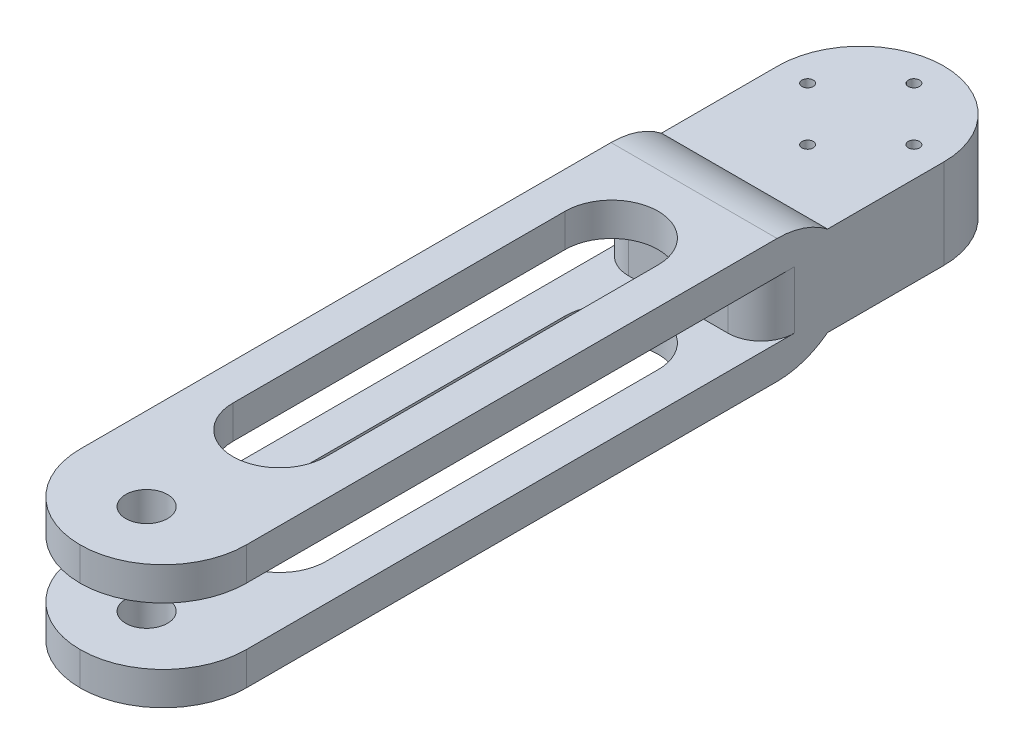
from build123d import *

# Parameters (mm, degrees)
BOSS_EXTRU_1_DEPTH      = 12.5
CONG_1_R                = 12.5
ESQUISSE2_R             = 0.85
ENL_V_MAT_EXTRU_1_DEPTH = 122.715469949
ESQUISSE3_R             = 3.15
ENL_V_MAT_EXTRU_2_DEPTH = 123.082236628
ENL_V_MAT_EXTRU_3_DEPTH = 123.082236628
CONG_2_R                = 5


with BuildPart() as part:
    # Esquisse1 → Boss.-Extru.1 (new, symmetric)
    with BuildSketch(Plane(origin=(0, 0, 0), x_dir=(0, 0, -1), z_dir=(1, 0, 0))):
        Polygon((90, 9.325), (-10, 9.325), (-10, 4.325), (80, 4.325), (80, -4.325), (-10, -4.325), (-10, -9.325), (90, -9.325), (90, -6.75), (120, -6.75), (120, 6.75), (90, 6.75), align=None)
    extrude(amount=BOSS_EXTRU_1_DEPTH, both=True)

    # Congé1
    # the kernel refuses this fillet: 12.5 mm, written as the material it takes off along each edge
    with BuildSketch(Plane(origin=(-31.497429925, -9.325, -90), x_dir=(0, 1, 0), z_dir=(1, 0, 0))) as cong_1_piece_1:
        with BuildLine():
            CenterArc((12.5, 7.59897197), CONG_1_R, 180, 37.439095089)
            Line((0, 7.59897197), (-0.25, 7.59897197))
            Line((-0.25, 7.59897197), (-0.25, 0))
            Line((-0.25, 0), (0, -0.25))
            ThreePointArc((0, -0.25), (1.2875, -0.25), (2.3765, -0.151979439))
            Line((2.3765, -0.151979439), (2.575, 0))
        make_face()
    extrude(amount=62.99485985, mode=Mode.SUBTRACT)
    with BuildSketch(Plane(origin=(31.497429925, 9.325, -90), x_dir=(0, 0, 1), z_dir=(-1, 0, 0))) as cong_1_piece_2:
        with BuildLine():
            CenterArc((7.59897197, -12.5), CONG_1_R, 90, 37.439095089)
            Line((0, -2.575), (-0.151979439, -2.3765))
            ThreePointArc((-0.151979439, -2.3765), (-0.25, -1.2875), (-0.25, 0))
            Line((-0.25, 0), (0, 0.25))
            Line((0, 0.25), (7.59897197, 0.25))
            Line((7.59897197, 0.25), (7.59897197, 0))
        make_face()
    extrude(amount=62.99485985, mode=Mode.SUBTRACT)
    with BuildSketch(Plane(origin=(-12.5, 26.925, 10), x_dir=(1, 0, 0), z_dir=(0, -1, 0)), Plane(origin=(-12.5, 40.575, 10), x_dir=(1, 0, 0), z_dir=(0, -1, 0)), Plane(origin=(12.5, 40.575, 10), x_dir=(0, 0, -1), z_dir=(0, -1, 0))) as cong_1_piece_3:
        with BuildLine():
            CenterArc((CONG_1_R, -CONG_1_R), CONG_1_R, 90, 90)
            Line((0, -CONG_1_R), (-CONG_1_R * 0.02, -CONG_1_R))
            Line((-CONG_1_R * 0.02, -CONG_1_R), (-CONG_1_R * 0.02, CONG_1_R * 0.02))
            Line((-CONG_1_R * 0.02, CONG_1_R * 0.02), (CONG_1_R, CONG_1_R * 0.02))
            Line((CONG_1_R, CONG_1_R * 0.02), (CONG_1_R, 0))
        make_face()
    extrude(amount=67.5, mode=Mode.SUBTRACT)
    with BuildSketch(Plane(origin=(12.5, 26.925, 10), x_dir=(-1, 0, 0), z_dir=(0, -1, 0))) as cong_1_piece_4:
        with BuildLine():
            CenterArc((CONG_1_R, CONG_1_R), CONG_1_R, 180, 90)
            Line((0, CONG_1_R), (-CONG_1_R * 0.02, CONG_1_R))
            Line((-CONG_1_R * 0.02, CONG_1_R), (-CONG_1_R * 0.02, -CONG_1_R * 0.02))
            Line((-CONG_1_R * 0.02, -CONG_1_R * 0.02), (CONG_1_R, -CONG_1_R * 0.02))
            Line((CONG_1_R, -CONG_1_R * 0.02), (CONG_1_R, 0))
        make_face()
    extrude(amount=67.5, mode=Mode.SUBTRACT)
    with BuildSketch(Plane(origin=(-12.5, -38, -120), x_dir=(1, 0, 0), z_dir=(0, 1, 0))) as cong_1_piece_5:
        with BuildLine():
            CenterArc((CONG_1_R, -CONG_1_R), CONG_1_R, 90, 90)
            Line((0, -CONG_1_R), (-CONG_1_R * 0.02, -CONG_1_R))
            Line((-CONG_1_R * 0.02, -CONG_1_R), (-CONG_1_R * 0.02, CONG_1_R * 0.02))
            Line((-CONG_1_R * 0.02, CONG_1_R * 0.02), (CONG_1_R, CONG_1_R * 0.02))
            Line((CONG_1_R, CONG_1_R * 0.02), (CONG_1_R, 0))
        make_face()
    extrude(amount=76, mode=Mode.SUBTRACT)
    with BuildSketch(Plane(origin=(12.5, -38, -120), x_dir=(-1, 0, 0), z_dir=(0, 1, 0))) as cong_1_piece_6:
        with BuildLine():
            CenterArc((CONG_1_R, CONG_1_R), CONG_1_R, 180, 90)
            Line((0, CONG_1_R), (-CONG_1_R * 0.02, CONG_1_R))
            Line((-CONG_1_R * 0.02, CONG_1_R), (-CONG_1_R * 0.02, -CONG_1_R * 0.02))
            Line((-CONG_1_R * 0.02, -CONG_1_R * 0.02), (CONG_1_R, -CONG_1_R * 0.02))
            Line((CONG_1_R, -CONG_1_R * 0.02), (CONG_1_R, 0))
        make_face()
    extrude(amount=76, mode=Mode.SUBTRACT)

    # Esquisse2 → Enlèv. mat.-Extru.1 (cut, through all)
    with BuildSketch(Plane(origin=(0, 6.75, 0), x_dir=(1, 0, 0), z_dir=(0, 1, 0))):
        with Locations(Location((8, 107.5, 0), (0, 0, 270))):
            Circle(ESQUISSE2_R)
        with Locations(Location((0, 115.5, 0), (0, 0, 270))):
            Circle(ESQUISSE2_R)
        with Locations(Location((-8, 107.5, 0), (0, 0, 270))):
            Circle(ESQUISSE2_R)
        with Locations(Location((0, 99.5, 0), (0, 0, 270))):
            Circle(ESQUISSE2_R)
    extrude(amount=-ENL_V_MAT_EXTRU_1_DEPTH, mode=Mode.SUBTRACT)

    # Esquisse3 → Enlèv. mat.-Extru.2 (cut, through all)
    with BuildSketch(Plane(origin=(0, 9.325, 0), x_dir=(1, 0, 0), z_dir=(0, 1, 0))):
        with Locations(Location((0, 0, 0), (0, 0, 270))):
            Circle(ESQUISSE3_R)
    extrude(amount=-ENL_V_MAT_EXTRU_2_DEPTH, mode=Mode.SUBTRACT)

    # Esquisse4 → Enlèv. mat.-Extru.3 (cut, through all)
    with BuildSketch(Plane(origin=(0, 9.325, 0), x_dir=(1, 0, 0), z_dir=(0, 1, 0))):
        with BuildLine():
            Line((-7, 70), (-7, 20))
            ThreePointArc((-7, 20), (0, 13), (7, 20))
            Line((7, 20), (7, 70))
            ThreePointArc((7, 70), (0, 77), (-7, 70))
        make_face()
    extrude(amount=-ENL_V_MAT_EXTRU_3_DEPTH, mode=Mode.SUBTRACT)

    # Congé2
    cong_2_edges = [part.edges().sort_by_distance(p)[0] for p in [
        (12.5, 0, -80),
        (-12.5, 0, -80),
    ]]
    fillet(cong_2_edges, radius=CONG_2_R)


solid = part.part
